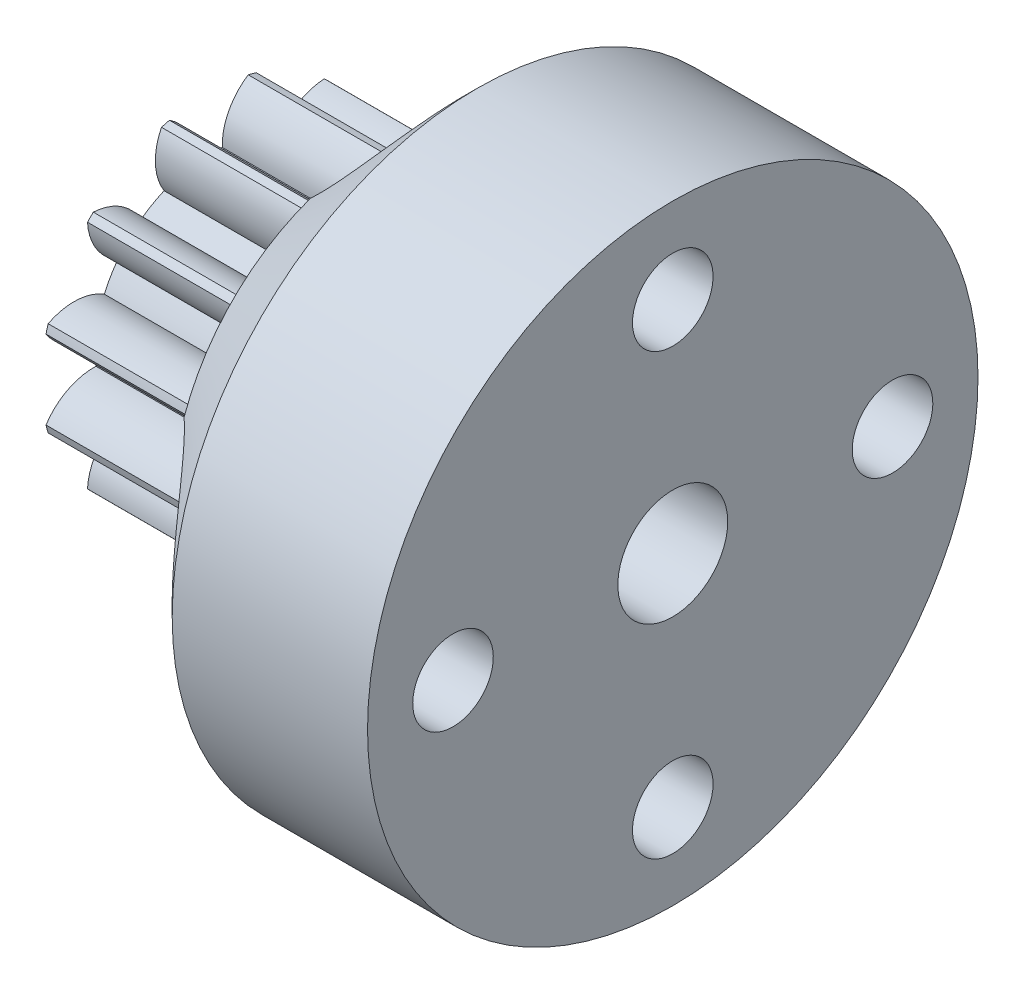
from build123d import *

# Parameters (mm, degrees)
BASPROSKE_W         = 7
BASPROSKE_H         = 6.86
TOOTHCUT_DEPTH      = 12.963243707
TEETHCUTS_COUNT     = 12
TEETHCUTS_ANGLE     = 330
BORSKE_R            = 1
BORE_DEPTH          = 50.0000508
SKETCH1_R           = 12.5
BOSS_EXTRUDE1_DEPTH = 12
SKETCH2_R           = 1.65
CUT_EXTRUDE1_DEPTH  = 22.365860619
SKETCH3_R           = 3
CUT_EXTRUDE2_DEPTH  = 9
CIRPATTERN1_COUNT   = 4
CHAMFER1_SIZE       = 4
SKETCH4_R           = 2.25
CUT_EXTRUDE3_DEPTH  = 6


with BuildPart() as part:
    # BasProSke → Base-Revolve (revolve)
    with BuildSketch(Plane(origin=(0, 0, 0), x_dir=(1, 0, 0), z_dir=(0, 1, 0)), mode=Mode.PRIVATE) as base_revolve_sk:
        with Locations((3.5, 3.43)):
            Rectangle(BASPROSKE_W, BASPROSKE_H)
    revolve(base_revolve_sk.sketch.rotate(Axis((-10, 0, 0), (1, 0, 0)), 180), axis=Axis((-10, 0, 0), (1, 0, 0)))

    # TooCutSke → ToothCut (cut, through all)
    with BuildSketch(Plane(origin=(0, 0, 0), x_dir=(0, 0, -1), z_dir=(1, 0, 0))):
        with BuildLine():
            ThreePointArc((0.552016647, 4.621146354), (0, 4.654), (-0.552016647, 4.621146354))
            ThreePointArc((-0.552016647, 4.621146354), (-0.822258441, 5.798784691), (-1.641510828, 6.686865885))
            ThreePointArc((-1.641510828, 6.686865885), (0, 6.8854), (1.641510828, 6.686865885))
            ThreePointArc((1.641510828, 6.686865885), (0.822258441, 5.798784691), (0.552016647, 4.621146354))
        make_face()
    toothcut = extrude(amount=TOOTHCUT_DEPTH, mode=Mode.SUBTRACT)

    # TeethCuts: ToothCut ×12 about axis
    teethcuts_axis = Axis((-10, 0, 0), (1, 0, 0))
    for i in range(1, TEETHCUTS_COUNT):
        add(toothcut.rotate(teethcuts_axis, i * TEETHCUTS_ANGLE / (TEETHCUTS_COUNT - 1)), mode=Mode.SUBTRACT)

    # BorSke → Bore (cut, symmetric)
    with BuildSketch(Plane(origin=(0, 0, 0), x_dir=(0, 0, -1), z_dir=(1, 0, 0))):
        with Locations(Location((0, 0, 0), (0, 0, 180))):
            Circle(BORSKE_R)
    extrude(amount=BORE_DEPTH, both=True, mode=Mode.SUBTRACT)

    # Sketch1 → Boss-Extrude1 (add)
    with BuildSketch(Plane(origin=(7, 0, 0), x_dir=(0, 0, -1), z_dir=(1, 0, 0))):
        Circle(SKETCH1_R)
    extrude(amount=BOSS_EXTRUDE1_DEPTH)

    # Sketch2 → Cut-Extrude1 (cut, through all)
    with BuildSketch(Plane.ZY.offset(-7)):
        with Locations((0, 9)):
            Circle(SKETCH2_R)
    cut_extrude1 = extrude(amount=-CUT_EXTRUDE1_DEPTH, mode=Mode.SUBTRACT)

    # Sketch3 → Cut-Extrude2 (cut)
    with BuildSketch(Plane.ZY.offset(-7)):
        with Locations(Location((0, 9, 0), (0, 0, 307.326549715))):
            Circle(SKETCH3_R)
    cut_extrude2 = extrude(amount=-CUT_EXTRUDE2_DEPTH, mode=Mode.SUBTRACT)

    # CirPattern1: Cut-Extrude1, Cut-Extrude2 ×4 about axis
    cirpattern1_axis = Axis((0, 0, 0), (1, 0, 0))
    add([cut_extrude1.rotate(cirpattern1_axis, i * 360 / CIRPATTERN1_COUNT) for i in range(1, CIRPATTERN1_COUNT)], mode=Mode.SUBTRACT)
    add([cut_extrude2.rotate(cirpattern1_axis, i * 360 / CIRPATTERN1_COUNT) for i in range(1, CIRPATTERN1_COUNT)], mode=Mode.SUBTRACT)

    # Chamfer1
    # the kernel refuses this chamfer: 4 mm, written as the material it takes off along each edge
    with BuildSketch(Plane(origin=(7, 0, 0), x_dir=(0, 0, -1), z_dir=(0, -1, 0))) as chamfer1_piece_1:
        Polygon((12.5, CHAMFER1_SIZE), (12.5 - CHAMFER1_SIZE, 0), (12.5, 0), align=None)
    revolve(axis=Axis((7, 0, 0), (1, 0, 0)), mode=Mode.SUBTRACT)

    # Sketch4 → Cut-Extrude3 (cut)
    with BuildSketch(Plane(origin=(19, 0, 0), x_dir=(0, 0, -1), z_dir=(1, 0, 0))):
        Circle(SKETCH4_R)
    extrude(amount=-CUT_EXTRUDE3_DEPTH, mode=Mode.SUBTRACT)


solid = part.part
